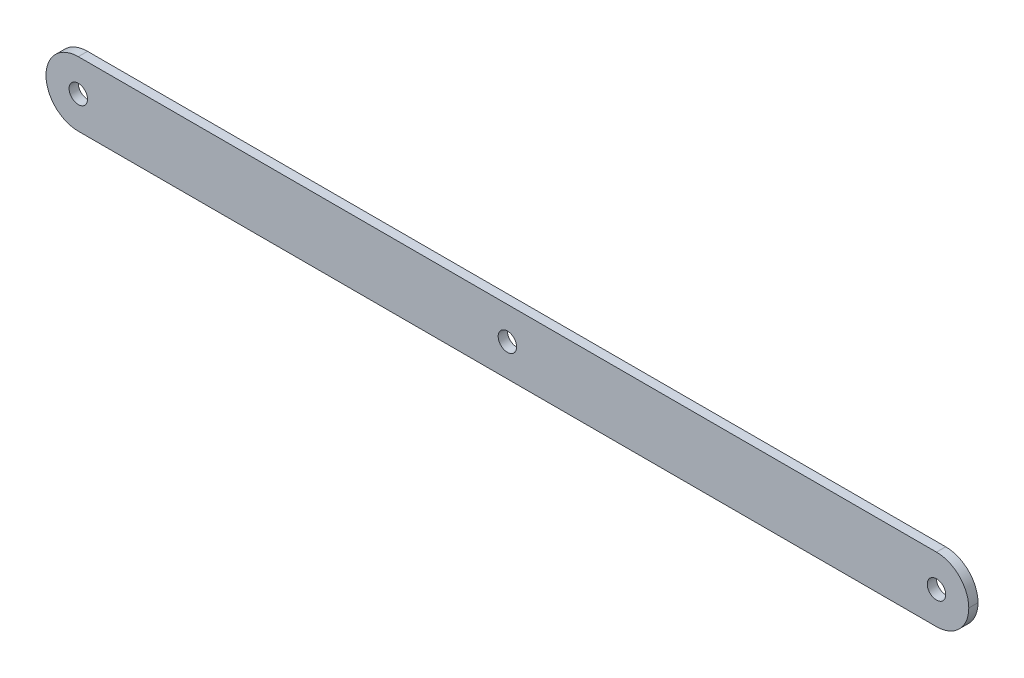
from build123d import *

# Parameters (mm, degrees)
SKETCH1_W           = 500
SKETCH1_H           = 35
BOSS_EXTRUDE1_DEPTH = 2.5
FILLET1_R           = 17.5
SKETCH2_R           = 5
CUT_EXTRUDE1_DEPTH  = 5


with BuildPart() as part:
    # Sketch1 → Boss-Extrude1 (new, symmetric)
    with BuildSketch(Plane.XY):
        Rectangle(SKETCH1_W, SKETCH1_H)
    extrude(amount=BOSS_EXTRUDE1_DEPTH, both=True)

    # Fillet1
    fillet1_edges = [part.edges().sort_by_distance(p)[0] for p in [
        (-250, -17.5, 0),
        (-250, 17.5, 0),
        (250, -17.5, 0),
        (250, 17.5, 0),
    ]]
    fillet(fillet1_edges, radius=FILLET1_R - 0.0001)  # a hair under: the kernel refuses the full size

    # Sketch2 → Cut-Extrude1 (cut)
    with BuildSketch(Plane.XY.offset(2.5)):
        Circle(SKETCH2_R)
        with Locations((232.5, 0)):
            Circle(SKETCH2_R)
        with Locations(Location((-232.5, 0, 0), (0, 0, 180))):
            Circle(SKETCH2_R)
    extrude(amount=-CUT_EXTRUDE1_DEPTH, mode=Mode.SUBTRACT)


solid = part.part
